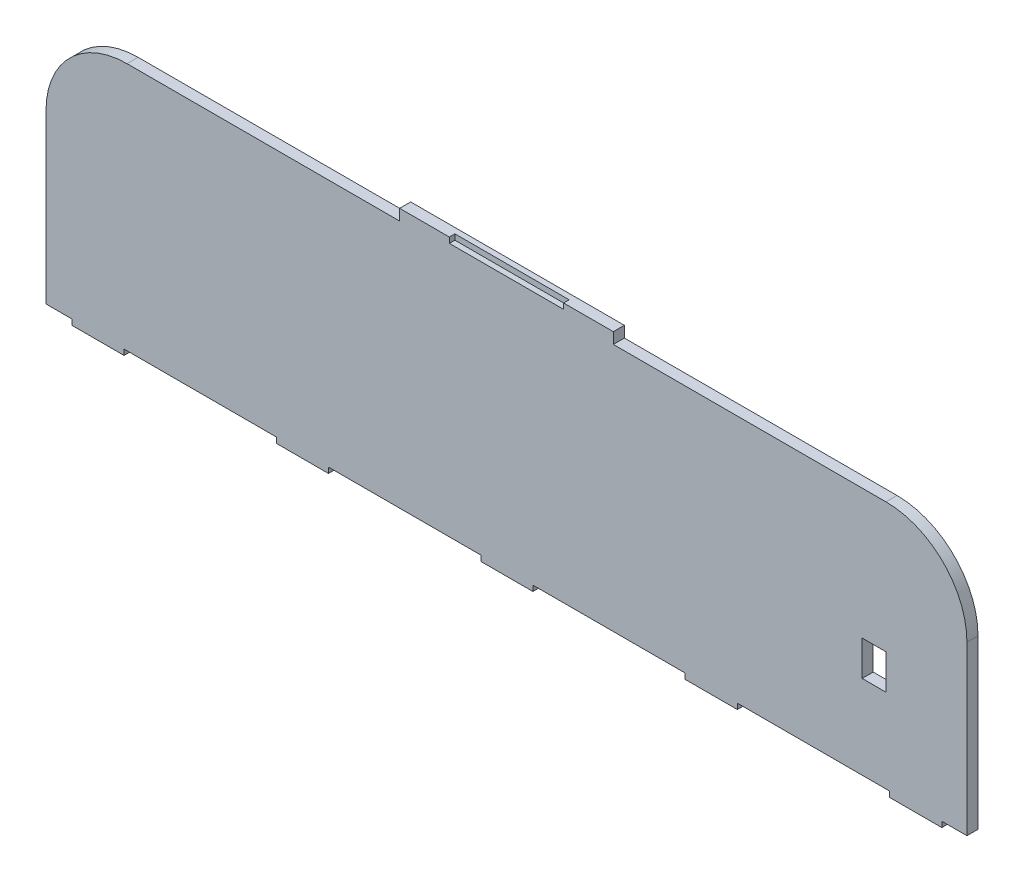
from build123d import *

# Parameters (mm, degrees)
STOCK_BACK_1_OUTLINE_W = 12.9
STOCK_BACK_1_OUTLINE_H = 19
STOCK_BACK_1_DEPTH     = 6
SKETCH2_W              = 28.3
SKETCH2_H              = 3
BOSS_EXTRUDE2_DEPTH    = 6
LPATTERN2_COUNT        = 5
LPATTERN2_PITCH        = 111
SKETCH3_W              = 116
SKETCH3_H              = 6
BOSS_EXTRUDE4_DEPTH    = 6
CUT_EXTRUDE1_DEPTH     = 3


# Read off the part's stored shape, not the designer's step: Stock-Back-1
with BuildPart() as part:
    # Stock-Back-1 outline → Stock-Back-1 (new body)
    with BuildSketch(Plane.XY):
        with BuildLine():
            Line((0, 457), (0, 366))
            Line((0, 366), (500, 366))
            Line((500, 366), (500, 457))
            ThreePointArc((500, 457), (487.112698372, 488.112698372), (456, 501))
            Line((456, 501), (44, 501))
            ThreePointArc((44, 501), (12.887301628, 488.112698372), (0, 457))
        make_face()
        with Locations((449.55, 421)):
            Rectangle(STOCK_BACK_1_OUTLINE_W, STOCK_BACK_1_OUTLINE_H, mode=Mode.SUBTRACT)
    extrude(amount=STOCK_BACK_1_DEPTH)

    # Sketch2 → Boss-Extrude2 (add)
    with BuildSketch(Plane(origin=(0, 0, 0), x_dir=(-1, 0, 0), z_dir=(0, 0, -1))):
        with Locations((-472.2, 364.5)):
            Rectangle(SKETCH2_W, SKETCH2_H)
    boss_extrude2 = extrude(amount=-BOSS_EXTRUDE2_DEPTH)

    # LPattern2: Boss-Extrude2 ×5
    with Locations(*[(-i * LPATTERN2_PITCH, 0, 0) for i in range(1, LPATTERN2_COUNT)]):
        add(boss_extrude2)

    # Sketch3 → Boss-Extrude4 (add)
    with BuildSketch(Plane(origin=(0, 0, 0), x_dir=(-1, 0, 0), z_dir=(0, 0, -1))):
        with Locations((-250, 504)):
            Rectangle(SKETCH3_W, SKETCH3_H)
    extrude(amount=-BOSS_EXTRUDE4_DEPTH)

    # Sketch4 → Cut-Extrude1 (cut)
    with BuildSketch(Plane(origin=(0, 507, 0), x_dir=(1, 0, 0), z_dir=(0, 1, 0))):
        with BuildLine():
            Line((219, -6), (281, -6))
            Line((281, -6), (281, -5))
            ThreePointArc((281, -5), (280.414213562, -3.585786438), (279, -3))
            Line((279, -3), (221, -3))
            ThreePointArc((221, -3), (219.585786438, -3.585786438), (219, -5))
            Line((219, -5), (219, -6))
        make_face()
        with BuildLine():
            Line((219, -3), (219, -5))
            ThreePointArc((219, -5), (219.585786438, -3.585786438), (221, -3))
            Line((221, -3), (219, -3))
        make_face()
        with BuildLine():
            ThreePointArc((279, -3), (280.414213562, -3.585786438), (281, -5))
            Line((281, -5), (281, -3))
            Line((281, -3), (279, -3))
        make_face()
    extrude(amount=-CUT_EXTRUDE1_DEPTH, mode=Mode.SUBTRACT)


solid = part.part
